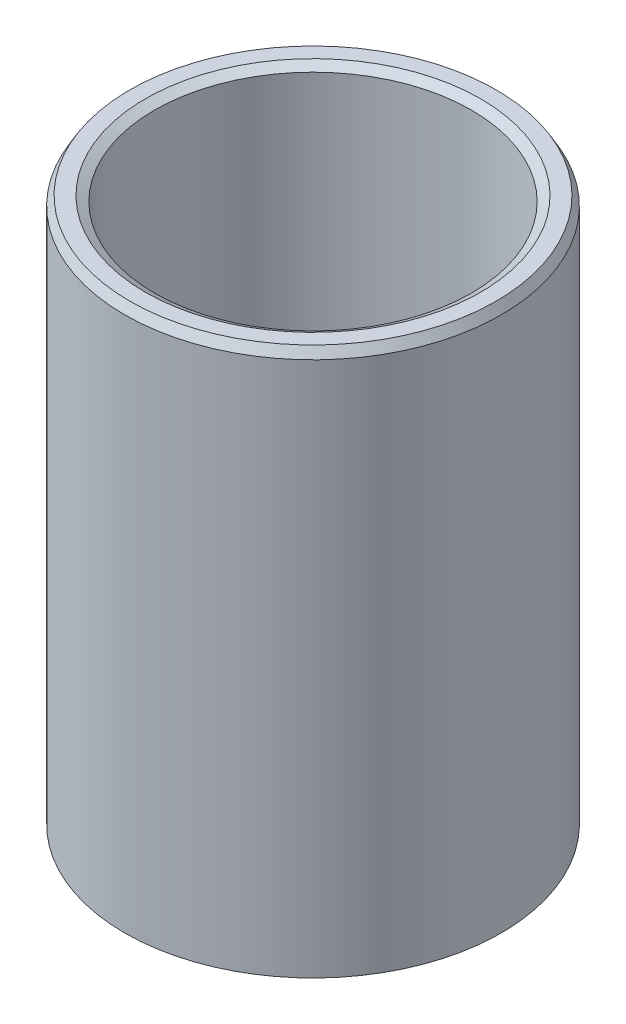
from build123d import *
from OCP.BRepFilletAPI import BRepFilletAPI_MakeChamfer

# Parameters (mm, degrees)
SKETCH1_R           = 25
BOSS_EXTRUDE1_DEPTH = 72.956612844
SKETCH2_R           = 21.034789797
CUT_EXTRUDE1_DEPTH  = 82.071988736
CHAMFER1_SIZE       = 1.209449842
CHAMFER1_SIZE2      = 0.698276192


with BuildPart() as part:
    # Sketch1 → Boss-Extrude1 (new body)
    with BuildSketch(Plane(origin=(0, 0, 0), x_dir=(1, 0, 0), z_dir=(0, 1, 0))):
        Circle(SKETCH1_R)
    extrude(amount=BOSS_EXTRUDE1_DEPTH)

    # Sketch2 → Cut-Extrude1 (cut, through all)
    with BuildSketch(Plane(origin=(0, 0, 0), x_dir=(1, 0, 0), z_dir=(0, 1, 0))):
        Circle(SKETCH2_R)
    extrude(amount=CUT_EXTRUDE1_DEPTH, mode=Mode.SUBTRACT)

    # Chamfer1: one chamfer whose edges measure the first distance from different faces: ONE call of the kernel's chamfer builder (chamfer() names one face for all edges)
    chamfer1_edges_1 = [part.edges().sort_by_distance(p)[0] for p in [
        (-21.034789797, 72.956612844, 0),
    ]]
    chamfer1_side_1 = [part.faces().sort_by_distance(p)[0] for p in [
        (-24.292893219, 72.956612844, 0),
    ]]
    chamfer1_edges_2 = [part.edges().sort_by_distance(p)[0] for p in [
        (-21.034789797, 0, 0),
    ]]
    chamfer1_side_2 = [part.faces().sort_by_distance(p)[0] for p in [
        (-21.034789797, 36.478306422, 0),
    ]]
    chamfer1_edges_3 = [part.edges().sort_by_distance(p)[0] for p in [
        (-25, 0, 0),
    ]]
    chamfer1_side_3 = [part.faces().sort_by_distance(p)[0] for p in [
        (-24.292893219, 0, 0),
    ]]
    chamfer1_edges_4 = [part.edges().sort_by_distance(p)[0] for p in [
        (-25, 72.956612844, 0),
    ]]
    chamfer1_side_4 = [part.faces().sort_by_distance(p)[0] for p in [
        (-25, 36.478306422, 0),
    ]]
    chamfer1 = BRepFilletAPI_MakeChamfer(part.part.solid().wrapped)
    for e in chamfer1_edges_1:
        chamfer1.Add(CHAMFER1_SIZE, CHAMFER1_SIZE2, e.wrapped, chamfer1_side_1[0].wrapped)  # the first distance lies on this face
    for e in chamfer1_edges_2:
        chamfer1.Add(CHAMFER1_SIZE, CHAMFER1_SIZE2, e.wrapped, chamfer1_side_2[0].wrapped)  # the first distance lies on this face
    for e in chamfer1_edges_3:
        chamfer1.Add(CHAMFER1_SIZE, CHAMFER1_SIZE2, e.wrapped, chamfer1_side_3[0].wrapped)  # the first distance lies on this face
    for e in chamfer1_edges_4:
        chamfer1.Add(CHAMFER1_SIZE, CHAMFER1_SIZE2, e.wrapped, chamfer1_side_4[0].wrapped)  # the first distance lies on this face
    add(Compound.cast(chamfer1.Shape()), mode=Mode.REPLACE)


solid = part.part
